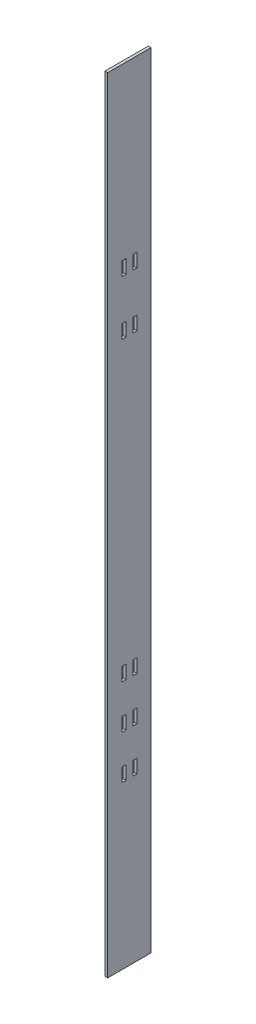
from build123d import *

# Parameters (mm, degrees)
SKETCH1_W                 = 50.8
SKETCH1_H                 = 914.4
BOSS_EXTRUDE1_DEPTH       = 3.175
SKETCH2_W                 = 4.7625
SKETCH2_H                 = 15.875
CUT_EXTRUDE1_DEPTH        = 458.916019184
LPATTERN1_COPY_1_SKETCH_W = 4.7625
LPATTERN1_COPY_1_SKETCH_H = 15.875
LPATTERN1_COPY_1_DEPTH    = 458.916019184
LPATTERN1_COPY_2_SKETCH_W = 4.7625
LPATTERN1_COPY_2_SKETCH_H = 15.875
LPATTERN1_COPY_2_DEPTH    = 458.916019184
LPATTERN1_COPY_3_SKETCH_W = 4.7625
LPATTERN1_COPY_3_SKETCH_H = 15.875
LPATTERN1_COPY_3_DEPTH    = 458.916019184
LPATTERN1_COPY_4_SKETCH_W = 4.7625
LPATTERN1_COPY_4_SKETCH_H = 15.875
LPATTERN1_COPY_4_DEPTH    = 458.916019184
LPATTERN1_COPY_5_SKETCH_W = 4.7625
LPATTERN1_COPY_5_SKETCH_H = 15.875
LPATTERN1_COPY_5_DEPTH    = 458.916019184
LPATTERN1_COPY_6_SKETCH_W = 4.7625
LPATTERN1_COPY_6_SKETCH_H = 15.875
LPATTERN1_COPY_6_DEPTH    = 458.916019184
SKETCH3_W                 = 4.7625
SKETCH3_H                 = 15.875
CUT_EXTRUDE2_DEPTH        = 458.916019184
LPATTERN2_COUNT           = 2
LPATTERN2_PITCH           = 63.5


with BuildPart() as part:
    # Sketch1 → Boss-Extrude1 (new body)
    with BuildSketch(Plane(origin=(0, 0, 0), x_dir=(0, 0, -1), z_dir=(1, 0, 0))):
        Rectangle(SKETCH1_W, SKETCH1_H)
    extrude(amount=BOSS_EXTRUDE1_DEPTH)

    # Sketch2 → Cut-Extrude1 (cut, through all)
    with BuildSketch(Plane(origin=(3.175, 0, 0), x_dir=(0, 0, -1), z_dir=(1, 0, 0))):
        with Locations((6.38125, -209.55)):
            Rectangle(SKETCH2_W, SKETCH2_H)
    cut_extrude1 = extrude(amount=-CUT_EXTRUDE1_DEPTH, mode=Mode.SUBTRACT)

    # Mirror1: Cut-Extrude1 across plane
    add(cut_extrude1.mirror(Plane.XY), mode=Mode.SUBTRACT)

    # LPattern1 copy 1 sketch → LPattern1 copy 1 (cut, through all)
    with BuildSketch(Plane(origin=(3.175, -50.8, 0), x_dir=(0, 0, 1), z_dir=(1, 0, 0))):
        with Locations((6.38125, 209.55)):
            Rectangle(LPATTERN1_COPY_1_SKETCH_W, LPATTERN1_COPY_1_SKETCH_H)
    extrude(amount=-LPATTERN1_COPY_1_DEPTH, mode=Mode.SUBTRACT)

    # LPattern1 copy 2 sketch → LPattern1 copy 2 (cut, through all)
    with BuildSketch(Plane(origin=(3.175, 50.8, 0), x_dir=(0, 0, 1), z_dir=(1, 0, 0))):
        with Locations((6.38125, 209.55)):
            Rectangle(LPATTERN1_COPY_2_SKETCH_W, LPATTERN1_COPY_2_SKETCH_H)
    extrude(amount=-LPATTERN1_COPY_2_DEPTH, mode=Mode.SUBTRACT)

    # LPattern1 copy 3 sketch → LPattern1 copy 3 (cut, through all)
    with BuildSketch(Plane(origin=(3.175, 0, 0), x_dir=(0, 0, 1), z_dir=(1, 0, 0))):
        with Locations((6.38125, 209.55)):
            Rectangle(LPATTERN1_COPY_3_SKETCH_W, LPATTERN1_COPY_3_SKETCH_H)
    extrude(amount=-LPATTERN1_COPY_3_DEPTH, mode=Mode.SUBTRACT)

    # LPattern1 copy 4 sketch → LPattern1 copy 4 (cut, through all)
    with BuildSketch(Plane(origin=(3.175, -50.8, 0), x_dir=(0, 0, -1), z_dir=(1, 0, 0))):
        with Locations((6.38125, -209.55)):
            Rectangle(LPATTERN1_COPY_4_SKETCH_W, LPATTERN1_COPY_4_SKETCH_H)
    extrude(amount=-LPATTERN1_COPY_4_DEPTH, mode=Mode.SUBTRACT)

    # LPattern1 copy 5 sketch → LPattern1 copy 5 (cut, through all)
    with BuildSketch(Plane(origin=(3.175, 50.8, 0), x_dir=(0, 0, -1), z_dir=(1, 0, 0))):
        with Locations((6.38125, -209.55)):
            Rectangle(LPATTERN1_COPY_5_SKETCH_W, LPATTERN1_COPY_5_SKETCH_H)
    extrude(amount=-LPATTERN1_COPY_5_DEPTH, mode=Mode.SUBTRACT)

    # LPattern1 copy 6 sketch → LPattern1 copy 6 (cut, through all)
    with BuildSketch(Plane(origin=(3.175, 0, 0), x_dir=(0, 0, -1), z_dir=(1, 0, 0))):
        with Locations((6.38125, -209.55)):
            Rectangle(LPATTERN1_COPY_6_SKETCH_W, LPATTERN1_COPY_6_SKETCH_H)
    extrude(amount=-LPATTERN1_COPY_6_DEPTH, mode=Mode.SUBTRACT)

    # Sketch3 → Cut-Extrude2 (cut, through all)
    with BuildSketch(Plane(origin=(3.175, 0, 0), x_dir=(0, 0, -1), z_dir=(1, 0, 0))):
        with Locations((6.38125, 187.325)):
            Rectangle(SKETCH3_W, SKETCH3_H)
        with Locations((-6.38125, 187.325)):
            Rectangle(SKETCH3_W, SKETCH3_H)
    cut_extrude2 = extrude(amount=-CUT_EXTRUDE2_DEPTH, mode=Mode.SUBTRACT)

    # LPattern2: Cut-Extrude2 ×2
    with Locations(*[(0, i * LPATTERN2_PITCH, 0) for i in range(1, LPATTERN2_COUNT)]):
        add(cut_extrude2, mode=Mode.SUBTRACT)


solid = part.part
